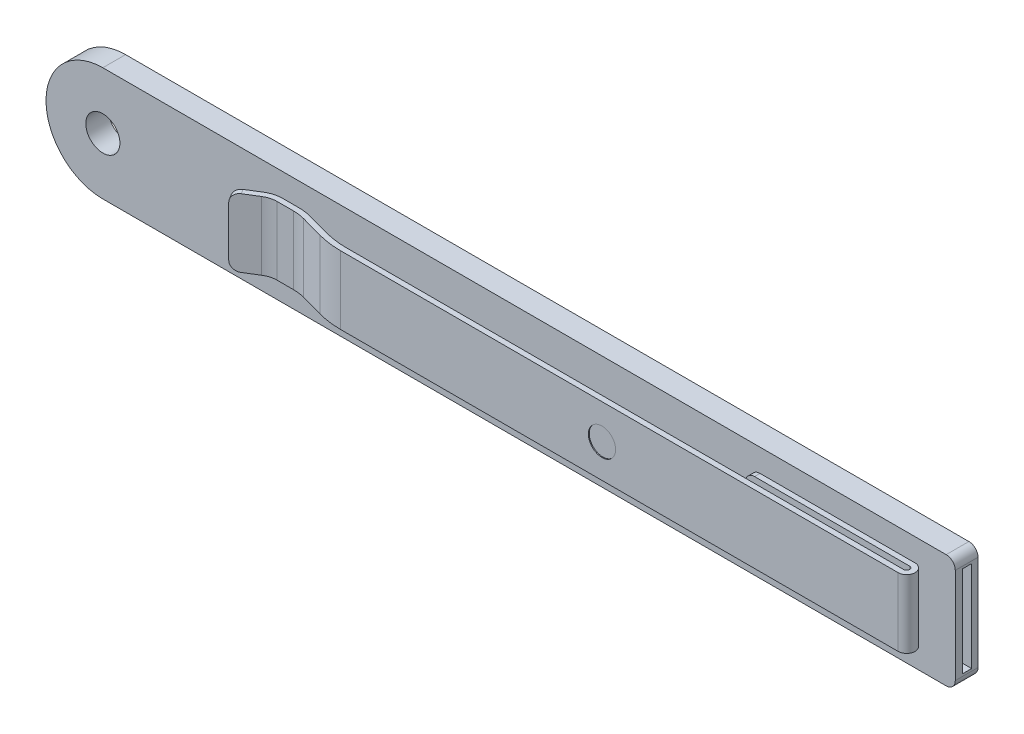
from build123d import *

# Parameters (mm, degrees)
SKETCH1_W           = 127
SKETCH1_H           = 3.175
BASE_EXTRUDE_DEPTH  = 15.875
FILLET1_R           = 7.9375
SKETCH2_R           = 2.38125
CUT_EXTRUDE1_DEPTH  = 66.531261624
SKETCH4_W           = 1.27
SKETCH4_H           = 12.7
CUT_EXTRUDE2_DEPTH  = 114.3
BOSS_EXTRUDE1_DEPTH = 4.7625
FILLET2_R           = 1.27
FILLET3_R           = 1.27
SKETCH8_R           = 1.905
CUT_EXTRUDE3_DEPTH  = 0.127


with BuildPart() as part:
    # Sketch1 → Base-Extrude (new body)
    with BuildSketch(Plane(origin=(0, 0, 0), x_dir=(1, 0, 0), z_dir=(0, 1, 0))):
        Rectangle(SKETCH1_W, SKETCH1_H)
    extrude(amount=BASE_EXTRUDE_DEPTH)

    # Fillet1
    fillet1_edges = [part.edges().sort_by_distance(p)[0] for p in [
        (-63.5, 15.875, 0),
        (-63.5, 0, 0),
    ]]
    fillet(fillet1_edges, radius=FILLET1_R - 0.0001)  # a hair under: the kernel refuses the full size

    # Sketch2 → Cut-Extrude1 (cut, through all)
    with BuildSketch(Plane.XY.offset(1.5875)):
        with Locations((-55.5625, 7.9375)):
            Circle(SKETCH2_R)
    extrude(amount=-CUT_EXTRUDE1_DEPTH, mode=Mode.SUBTRACT)

    # Sketch4 → Cut-Extrude2 (cut)
    with BuildSketch(Plane(origin=(63.5, 0, 0), x_dir=(0, 0, -1), z_dir=(1, 0, 0))):
        with Locations((0.0635, 7.9375)):
            Rectangle(SKETCH4_W, SKETCH4_H)
    extrude(amount=-CUT_EXTRUDE2_DEPTH, mode=Mode.SUBTRACT)

    # Fillet2
    fillet2_edges = [part.edges().sort_by_distance(p)[0] for p in [
        (63.5, 15.875, 0),
        (63.5, 0, 0),
    ]]
    fillet(fillet2_edges, radius=FILLET2_R)


with BuildPart() as body_2:
    # Sketch5 → Boss-Extrude1 (new, symmetric)
    with BuildSketch(Plane(origin=(0, 7.9375, 0), x_dir=(-1, 0, 0), z_dir=(0, 1, 0))):
        with BuildLine():
            Line((-34.954800237, 1.5875), (-57.883560189, 1.5875))
            ThreePointArc((-57.883560189, 1.5875), (-59.062352087, 2.766291898), (-57.883560189, 3.945083796))
            Line((-57.883560189, 3.945083796), (19.994775417, 3.945083796))
            ThreePointArc((19.994775417, 3.945083796), (21.6920601, 3.831156444), (23.358893265, 3.491418395))
            Line((23.358893265, 3.491418395), (26.450077985, 2.642257398))
            ThreePointArc((26.450077985, 2.642257398), (27.283494567, 2.472388373), (28.132136909, 2.415424698))
            Line((28.132136909, 2.415424698), (30.393068236, 2.415424698))
            ThreePointArc((30.393068236, 2.415424698), (31.262035394, 2.536653082), (32.064644452, 2.891080712))
            Line((32.064644452, 2.891080712), (34.911465551, 4.653982537))
            Line((34.911465551, 4.653982537), (35.312643843, 4.006139981))
            Line((35.312643843, 4.006139981), (32.465822744, 2.243238155))
            ThreePointArc((32.465822744, 2.243238155), (31.470587512, 1.803747895), (30.393068236, 1.653424698))
            Line((30.393068236, 1.653424698), (28.132136909, 1.653424698))
            ThreePointArc((28.132136909, 1.653424698), (27.181657486, 1.717224015), (26.248230914, 1.907477322))
            Line((26.248230914, 1.907477322), (23.157046194, 2.756638319))
            ThreePointArc((23.157046194, 2.756638319), (21.590223019, 3.075992085), (19.994775417, 3.183083796))
            Line((19.994775417, 3.183083796), (-57.883560189, 3.183083796))
            ThreePointArc((-57.883560189, 3.183083796), (-58.300352087, 2.766291898), (-57.883560189, 2.3495))
            Line((-57.883560189, 2.3495), (-34.954800237, 2.3495))
            Line((-34.954800237, 2.3495), (-34.954800237, 1.5875))
        make_face()
    extrude(amount=BOSS_EXTRUDE1_DEPTH, both=True)

    # Fillet3
    fillet3_edges = [body_2.edges().sort_by_distance(p)[0] for p in [
        (-35.112054697, 3.175, 4.330061259),
        (34.954800237, 3.175, 1.9685),
        (-35.112054697, 12.7, 4.330061259),
        (34.954800237, 12.7, 1.9685),
    ]]
    fillet(fillet3_edges, radius=FILLET3_R)

    # Sketch8 → Cut-Extrude3 (cut)
    with BuildSketch(Plane.XY.offset(3.945083796)):
        with Locations((16.511768765, 7.847518323)):
            Circle(SKETCH8_R)
    extrude(amount=-CUT_EXTRUDE3_DEPTH, mode=Mode.SUBTRACT)


solid = Compound([part.part, body_2.part])
